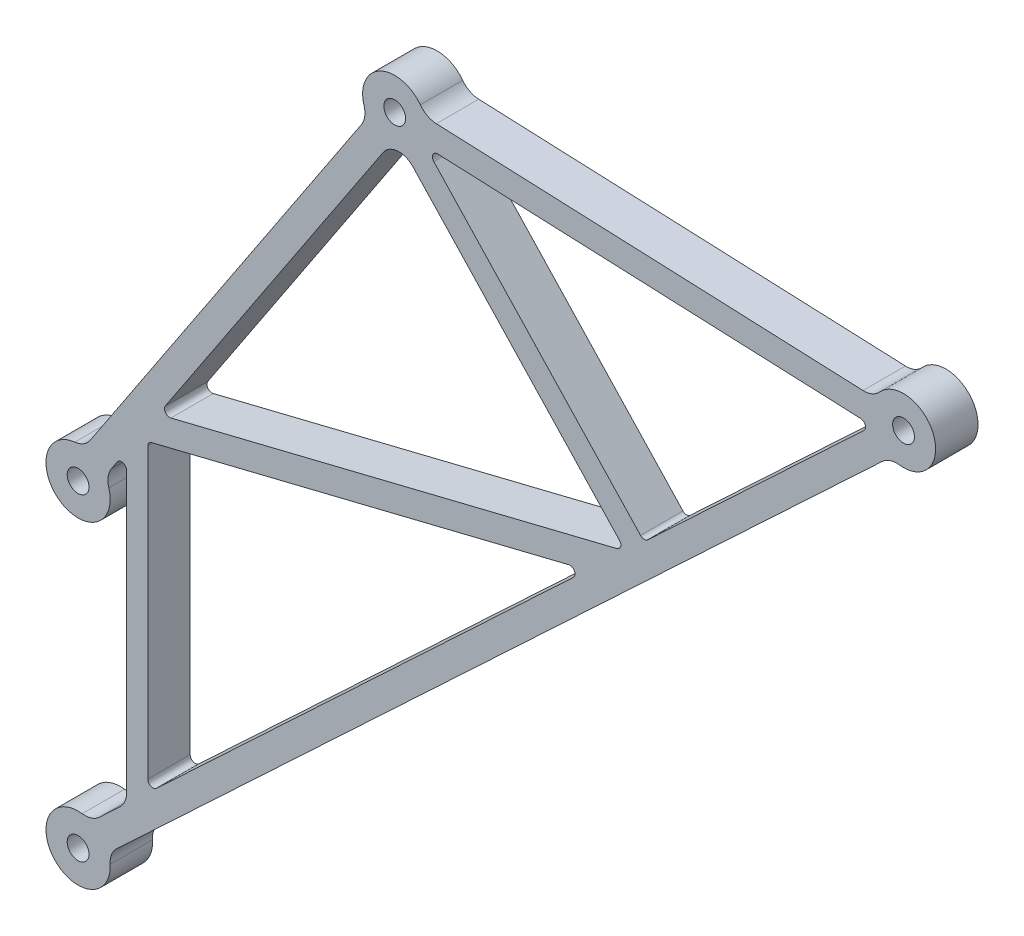
from build123d import *

# Parameters (mm, degrees)
SKETCH1_R           = 3.2639
BOSS_EXTRUDE1_DEPTH = 6.35
FILLET1_R           = 6.35
FILLET2_R           = 1.524
FILLET3_R           = 5.715


with BuildPart() as part:
    # Sketch1 → Boss-Extrude1 (new, symmetric)
    with BuildSketch(Plane.XY):
        with BuildLine():
            Line((1487.79576568, -158.784269308), (1487.79576568, -250.194499736))
            Line((1487.79576568, -250.194499736), (1477.101010284, -260.227049093))
            ThreePointArc((1477.101010284, -260.227049093), (1466.258468724, -275.622237688), (1482.314360626, -265.784510583))
            Line((1482.314360626, -265.784510583), (1716.673663322, -45.936446331))
            ThreePointArc((1716.673663322, -45.936446331), (1729.515779421, -33.768446492), (1711.843687849, -32.945436509))
            Line((1711.843687849, -32.945436509), (1577.08389596, -27.343328807))
            ThreePointArc((1577.08389596, -27.343328807), (1563.736723174, -22.220026544), (1560.05306912, -36.03400281))
            Line((1560.05306912, -36.03400281), (1474.973065059, -164.332851502))
            ThreePointArc((1474.973065059, -164.332851502), (1467.95688272, -181.806995965), (1481.323608223, -168.54414602))
            Line((1481.323608223, -168.54414602), (1487.79576568, -158.784269308))
        make_face()
        with Locations((1473.270132637, -269.04472734)):
            Circle(SKETCH1_R, mode=Mode.SUBTRACT)
        with Locations((1473.270132637, -173.79472734)):
            Circle(SKETCH1_R, mode=Mode.SUBTRACT)
        Polygon((1494.14576568, -153.132601519), (1625.870376064, -120.66929862), (1494.14576568, -244.23768389), align=None, mode=Mode.SUBTRACT)
        with BuildLine():
            Line((1571.366761462, -39.827649479), (1637.217429421, -110.024840786))
            Line((1637.217429421, -110.024840786), (1497.256271331, -144.518026652))
            Line((1497.256271331, -144.518026652), (1566.403612284, -40.245297328))
            ThreePointArc((1566.403612284, -40.245297328), (1568.912702914, -40.363462312), (1571.366761462, -39.827649479))
        make_face(mode=Mode.SUBTRACT)
        with Locations((1568.106544706, -30.78342149)):
            Circle(SKETCH1_R, mode=Mode.SUBTRACT)
        Polygon((1642.774890911, -104.811490444), (1577.264872597, -34.97743362), (1711.279538853, -40.548565657), align=None, mode=Mode.SUBTRACT)
        with Locations((1720.504540969, -37.118768084)):
            Circle(SKETCH1_R, mode=Mode.SUBTRACT)
    extrude(amount=BOSS_EXTRUDE1_DEPTH, both=True)

    # Fillet1
    fillet1_edges = [part.edges().sort_by_distance(p)[0] for p in [
        (1577.08389596, -27.343328807, 0),
        (1711.843687849, -32.945436509, 0),
        (1716.673663322, -45.936446331, 0),
        (1482.314360626, -265.784510583, 0),
        (1477.101010284, -260.227049093, 0),
        (1487.79576568, -250.194499736, 0),
        (1481.323608223, -168.54414602, 0),
        (1474.973065059, -164.332851502, 0),
        (1560.05306912, -36.03400281, 0),
    ]]
    fillet(fillet1_edges, radius=FILLET1_R)

    # Fillet2
    fillet2_edges = [part.edges().sort_by_distance(p)[0] for p in [
        (1494.14576568, -244.23768389, 0),
        (1625.870376064, -120.66929862, 0),
        (1494.14576568, -153.132601519, 0),
        (1642.774890911, -104.811490444, 0),
        (1711.279538853, -40.548565657, 0),
        (1577.264872597, -34.97743362, 0),
        (1497.256271331, -144.518026652, 0),
        (1637.217429421, -110.024840786, 0),
        (1487.79576568, -158.784269308, 0),
    ]]
    fillet(fillet2_edges, radius=FILLET2_R)

    # Fillet3
    fillet3_edges = [part.edges().sort_by_distance(p)[0] for p in [
        (1571.366761462, -39.827649479, 0),
    ]]
    fillet(fillet3_edges, radius=FILLET3_R)
    fillet3_2_edges = [part.edges().sort_by_distance(p)[0] for p in [
        (1566.403612284, -40.245297328, 0),
    ]]
    fillet(fillet3_2_edges, radius=FILLET3_R - 0.0001)  # a hair under: the kernel refuses the full size


solid = part.part
